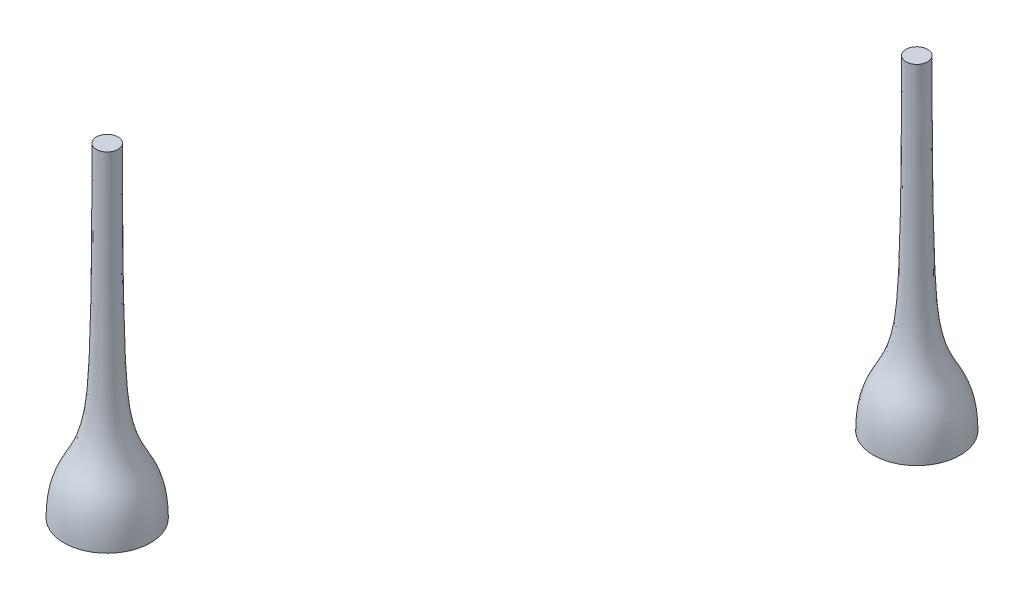
from build123d import *

# Parameters (mm, degrees)
CONVEX_CONE2_1_CONNECTED_OUTLINE_W = 0.5
CONVEX_CONE2_1_CONNECTED_OUTLINE_H = 15


# Read off the part's stored shape, not the designer's step: convex_cone2<1>@connected
with BuildPart() as part:
    # Sketch1 → Revolve8 (revolve)
    with BuildSketch(Plane.XY):
        with BuildLine():
            Line((0, 15), (0, 0))
            Line((0, 0), (2, 0))
            add(Edge.make_bspline(
                [(0.5, 15), (0.501667507, 9.660791997), (0.5714057, 5.994926019), (0.941978143, 2.03355611), (1.969950282, 2.351453197), (2, 0)],
                knots=[0, 0, 0, 0, 0.230231589, 0.330231589, 1, 1, 1, 1], degree=3))
            Line((0.5, 15), (0, 15))
        make_face()
    revolve(axis=Axis((0, 15, 0), (0, -1, 0)))


with BuildPart() as body_2:
    # convex_cone2<1>@connected outline → convex_cone2<1>@connected (revolve)
    with BuildSketch(Plane(origin=(-16.150540666, 0, 21.265182729), x_dir=(1, 0, 0), z_dir=(0, 0, 1))):
        with BuildLine():
            Line((0.5, -0.949235916), (2, -0.949235916))
            add(Edge.make_bspline(
                [(2, -0.949235916), (1.969950282, 1.402217281), (0.941978143, 1.084320194), (0.5714057, 5.045690103), (0.501667507, 8.711556081), (0.5, 14.050764084)],
                knots=[0, 0, 0, 0, 0.669768411, 0.769768411, 1, 1, 1, 1], degree=3))
            Line((0.5, 14.050764084), (0.5, -0.949235916))
        make_face()
        with Locations((0.25, 6.550764084)):
            Rectangle(CONVEX_CONE2_1_CONNECTED_OUTLINE_W, CONVEX_CONE2_1_CONNECTED_OUTLINE_H)
    revolve(axis=Axis((-16.150540666, 0, 21.265182729), (0, 1, 0)))


solid = Compound([part.part, body_2.part])
